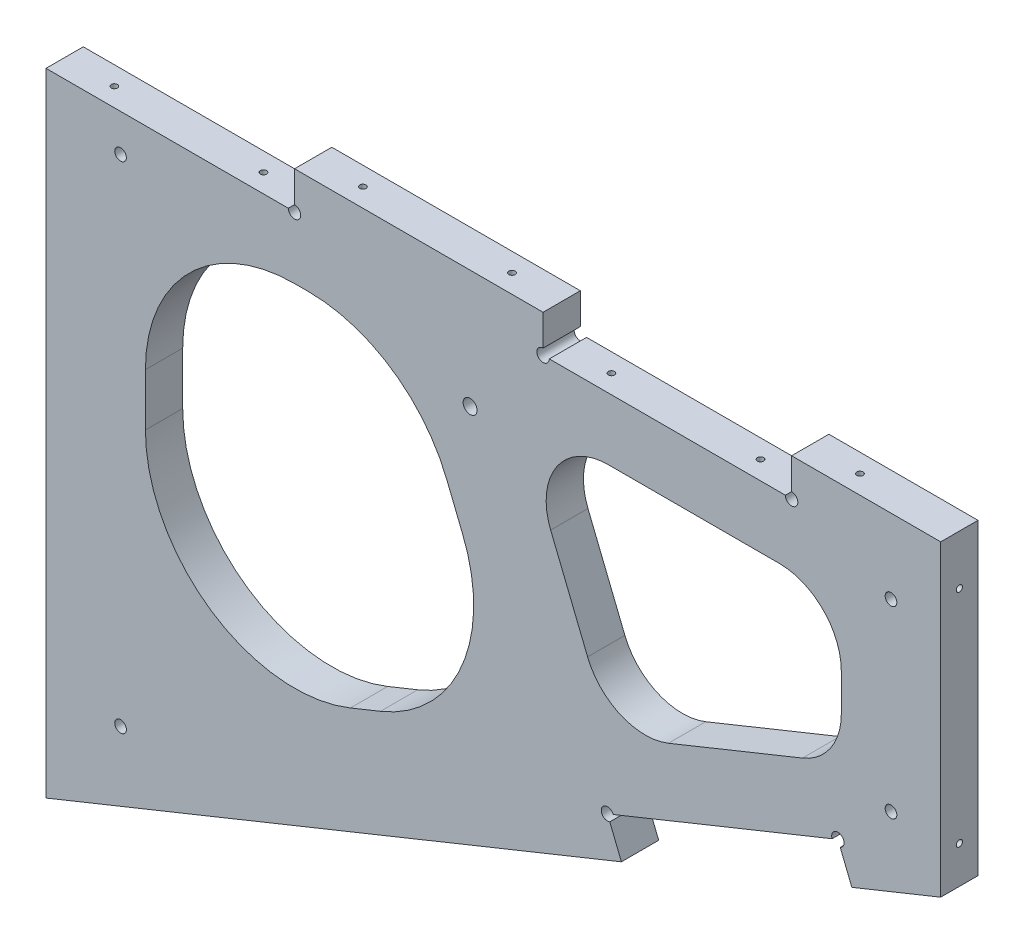
from build123d import *

# Parameters (mm, degrees)
BOSS_EXTRUDE1_DEPTH              = 19.05
CUT_EXTRUDE2_DEPTH               = 7658.473916494
FILLET1_R                        = 76.2
FILLET2_R                        = 31.75
SKETCH2_W                        = 127
SKETCH2_H                        = 19.05
CUT_EXTRUDE1_DEPTH               = 7658.473916494
F_1_4_0_25_DIAMETER_HOLE1_D      = 6.35
F_15_64_0_23438_DIAMETER_HOLE1_D = 5.953252
F_1_4_CLEARANCE_HOLE1_D          = 7.14248
HOLE1_D                          = 3.175
HOLE1_DEPTH                      = 50.8
HOLE1_CSINK_D                    = 10.16
HOLE1_CSINK_ANGLE                = 82
HOLE1_TIP                        = 0.953866233
HOLE2_D                          = 3.175
HOLE2_DEPTH                      = 38.1
HOLE2_CSINK_D                    = 10.16
HOLE2_CSINK_ANGLE                = 82
HOLE2_TIP                        = 0.953866233
HOLE3_D                          = 3.175
HOLE3_DEPTH                      = 50.8
HOLE3_CSINK_D                    = 10.16
HOLE3_CSINK_ANGLE                = 82
HOLE3_TIP                        = 0.953866233
HOLE4_D                          = 3.175
HOLE4_DEPTH                      = 38.1
HOLE4_CSINK_D                    = 10.16
HOLE4_CSINK_ANGLE                = 82
HOLE4_TIP                        = 0.953866233


with BuildPart() as part:
    # Sketch1 → Boss-Extrude1 (new body)
    with BuildSketch(Plane.XY):
        Polygon((3140.71, 6983.72999014), (2683.51, 6983.72999014), (2683.51, 6641.741886848), (3140.71, 6826.4626773), align=None)
    extrude(amount=BOSS_EXTRUDE1_DEPTH)

    # Sketch6 → Cut-Extrude2 (cut, through all)
    with BuildSketch(Plane(origin=(0, 0, 0), x_dir=(-1, 0, 0), z_dir=(0, 0, -1))):
        Polygon((-2923.76447292, 6932.92999014), (-3089.91, 6932.92999014), (-3089.91, 6860.727709955), (-2972.15765047, 6813.152672592), align=None)
        Polygon((-2925.056710658, 6794.122657646), (-2734.31, 6717.055984048), (-2734.31, 6932.92999014), (-2868.974907992, 6932.92999014), align=None)
    extrude(amount=-CUT_EXTRUDE2_DEPTH, mode=Mode.SUBTRACT)

    # Fillet1
    fillet1_edges = [part.edges().sort_by_distance(p)[0] for p in [
        (2734.31, 6932.92999014, 9.525),
        (2868.974907992, 6932.92999014, 9.525),
        (2925.056710658, 6794.122657646, 9.525),
        (2734.31, 6717.055984048, 9.525),
    ]]
    fillet(fillet1_edges, radius=FILLET1_R)

    # Fillet2
    fillet2_edges = [part.edges().sort_by_distance(p)[0] for p in [
        (3089.91, 6860.727709955, 9.525),
        (2972.15765047, 6813.152672592, 9.525),
        (2923.76447292, 6932.92999014, 9.525),
        (3089.91, 6932.92999014, 9.525),
    ]]
    fillet(fillet2_edges, radius=FILLET2_R)

    # Sketch2 → Cut-Extrude1 (cut, through all)
    with BuildSketch(Plane(origin=(0, 0, 0), x_dir=(-1, 0, 0), z_dir=(0, 0, -1))):
        with Locations((-2747.01, 6974.20499014)):
            Rectangle(SKETCH2_W, SKETCH2_H)
        with Locations((-3001.01, 6974.20499014)):
            Rectangle(SKETCH2_W, SKETCH2_H)
        Polygon((-2977.551881268, 6760.542518374), (-3095.304230798, 6808.117555738), (-3088.167975193, 6825.780408168), (-2970.415625663, 6778.205370804), align=None)
    extrude(amount=-CUT_EXTRUDE1_DEPTH, mode=Mode.SUBTRACT)

    # 1/4 (0.25) Diameter Hole1 (through all)
    with Locations(Plane(origin=(0, 0, 0), x_dir=(-1, 0, 0), z_dir=(0, 0, -1))):
        with Locations((-3088.167975193, 6825.780408168), (-2970.415625663, 6778.205370804), (-2937.51, 6964.67999014), (-3064.51, 6964.67999014), (-2810.51, 6964.67999014)):
            Hole(F_1_4_0_25_DIAMETER_HOLE1_D / 2)

    # 15/64 (0.23438) Diameter Hole1 (through all)
    with Locations(Plane.YX):
        with Locations((6692.541891629, 2721.610000001), (6945.629994921, 2721.610000001), (6945.629994921, 3115.310000001), (6851.60701674, 3115.310000001)):
            Hole(F_15_64_0_23438_DIAMETER_HOLE1_D / 2)

    # 1/4 Clearance Hole1 (through all)
    with Locations(Plane(origin=(0, 0, 0), x_dir=(-1, 0, 0), z_dir=(0, 0, -1))):
        with Locations((-2900.218040257, 6923.40499014)):
            Hole(F_1_4_CLEARANCE_HOLE1_D / 2)

    # Hole1
    with Locations(Plane(origin=(0, 7002.77999014, 247.523), x_dir=(0, 0, 1), z_dir=(0, 1, 0))):
        with Locations((0, 2696.21), (-237.998, 3089.91), (-237.998, 3039.11), (-237.998, 2962.91), (-237.998, 2912.11), (-237.998, 2835.91), (-237.998, 2785.11), (-237.998, 2708.91), (237.998, 2708.91), (237.998, 2785.11), (237.998, 2835.91), (237.998, 2912.11), (237.998, 2962.91), (237.998, 3039.11), (237.998, 3089.91), (0, 3051.81), (0, 2950.21), (0, 2797.81)):
            CounterSinkHole(HOLE1_D / 2, HOLE1_CSINK_D / 2, depth=HOLE1_DEPTH, counter_sink_angle=HOLE1_CSINK_ANGLE)
            with Locations((0, 0, -(HOLE1_DEPTH + HOLE1_TIP / 2))):  # 118° drill point
                Cone(0, HOLE1_D / 2, HOLE1_TIP, mode=Mode.SUBTRACT)

    # Hole2
    with Locations(Plane(origin=(3159.76, -4.781e-06, 247.523), x_dir=(0, 0, -1), z_dir=(1, 0, 0))):
        with Locations((-118.999, 6993.254994921), (237.998, 6993.254994921), (237.998, 6958.329994921), (237.998, 6845.512682081), (-237.998, 6993.254994921), (-237.998, 6958.329994921), (-237.998, 6845.512682081), (118.999, 6993.254994921)):
            CounterSinkHole(HOLE2_D / 2, HOLE2_CSINK_D / 2, depth=HOLE2_DEPTH, counter_sink_angle=HOLE2_CSINK_ANGLE)
            with Locations((0, 0, -(HOLE2_DEPTH + HOLE2_TIP / 2))):  # 118° drill point
                Cone(0, HOLE2_D / 2, HOLE2_TIP, mode=Mode.SUBTRACT)

    # Hole3
    with Locations(Plane(origin=(-1923.157317923, 4759.981389861, 247.523), x_dir=(0, 0, -1), z_dir=(0.37460659341595665, -0.9271838545667693, 0))):
        with Locations((237.998, 5442.50683469), (-237.998, 5442.50683469), (-237.998, 5394.88183469), (-237.998, 5318.68183469), (0, 5407.58183469), (0, 5305.98183469), (-237.998, 5267.88183469), (-237.998, 5130.866292514), (-237.998, 4993.850750338), (237.998, 4993.850750338), (237.998, 5130.866292514), (237.998, 5267.88183469), (237.998, 5318.68183469), (237.998, 5394.88183469)):
            CounterSinkHole(HOLE3_D / 2, HOLE3_CSINK_D / 2, depth=HOLE3_DEPTH, counter_sink_angle=HOLE3_CSINK_ANGLE)
            with Locations((0, 0, -(HOLE3_DEPTH + HOLE3_TIP / 2))):  # 118° drill point
                Cone(0, HOLE3_D / 2, HOLE3_TIP, mode=Mode.SUBTRACT)

    # Hole4
    with Locations(Plane(origin=(2664.46, -4.781e-06, 247.523), x_dir=(0, 0, 1), z_dir=(-1, 0, 0))):
        with Locations((-237.998, 6686.191891629), (237.998, 6686.191891629), (257.048, 6993.254994921), (218.948, 6993.254994921), (19.05, 6993.254994921), (237.998, 6939.279994921), (237.998, 6812.735943275), (-237.998, 6812.735943275), (-237.998, 6939.279994921), (-19.05, 6993.254994921), (-218.948, 6993.254994921), (-257.048, 6993.254994921)):
            CounterSinkHole(HOLE4_D / 2, HOLE4_CSINK_D / 2, depth=HOLE4_DEPTH, counter_sink_angle=HOLE4_CSINK_ANGLE)
            with Locations((0, 0, -(HOLE4_DEPTH + HOLE4_TIP / 2))):  # 118° drill point
                Cone(0, HOLE4_D / 2, HOLE4_TIP, mode=Mode.SUBTRACT)


solid = part.part
